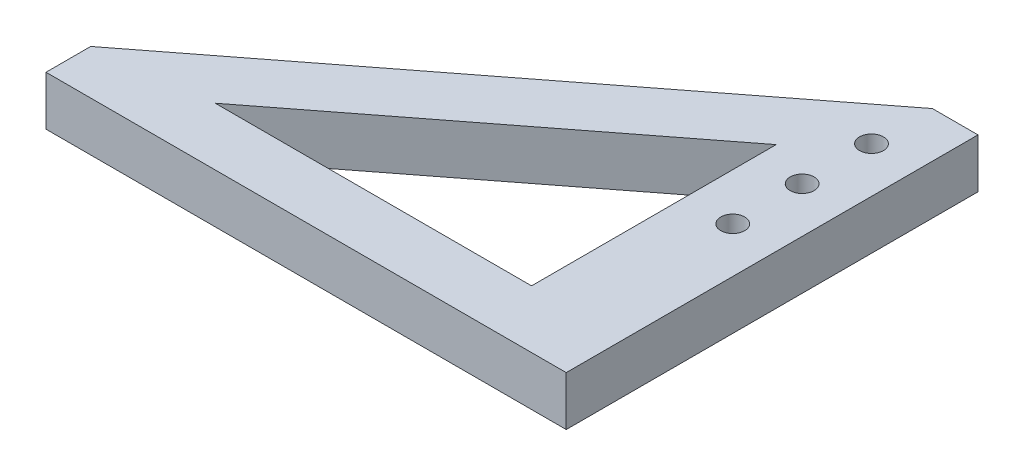
from build123d import *

# Parameters (mm, degrees)
SKETCH1_R           = 0.3937
BOSS_EXTRUDE1_DEPTH = 1.6256


with BuildPart() as part:
    # Sketch1 → Boss-Extrude1 (new body)
    with BuildSketch(Plane(origin=(0, 0, 0), x_dir=(1, 0, 0), z_dir=(0, 1, 0))):
        Polygon((1.905, 1.4732), (17.54785055, 13.570337759), (19.05, 13.570337759), (19.05, 0), (1.905, 0), align=None)
        with Locations((17.54785055, 11.562216741)):
            Circle(SKETCH1_R, mode=Mode.SUBTRACT)
        with Locations((17.54785055, 9.276216741)):
            Circle(SKETCH1_R, mode=Mode.SUBTRACT)
        with Locations((17.54785055, 6.990216741)):
            Circle(SKETCH1_R, mode=Mode.SUBTRACT)
        Polygon((5.577391241, 1.905), (16.002, 1.905), (16.002, 9.96669744), align=None, mode=Mode.SUBTRACT)
    extrude(amount=BOSS_EXTRUDE1_DEPTH)


solid = part.part
